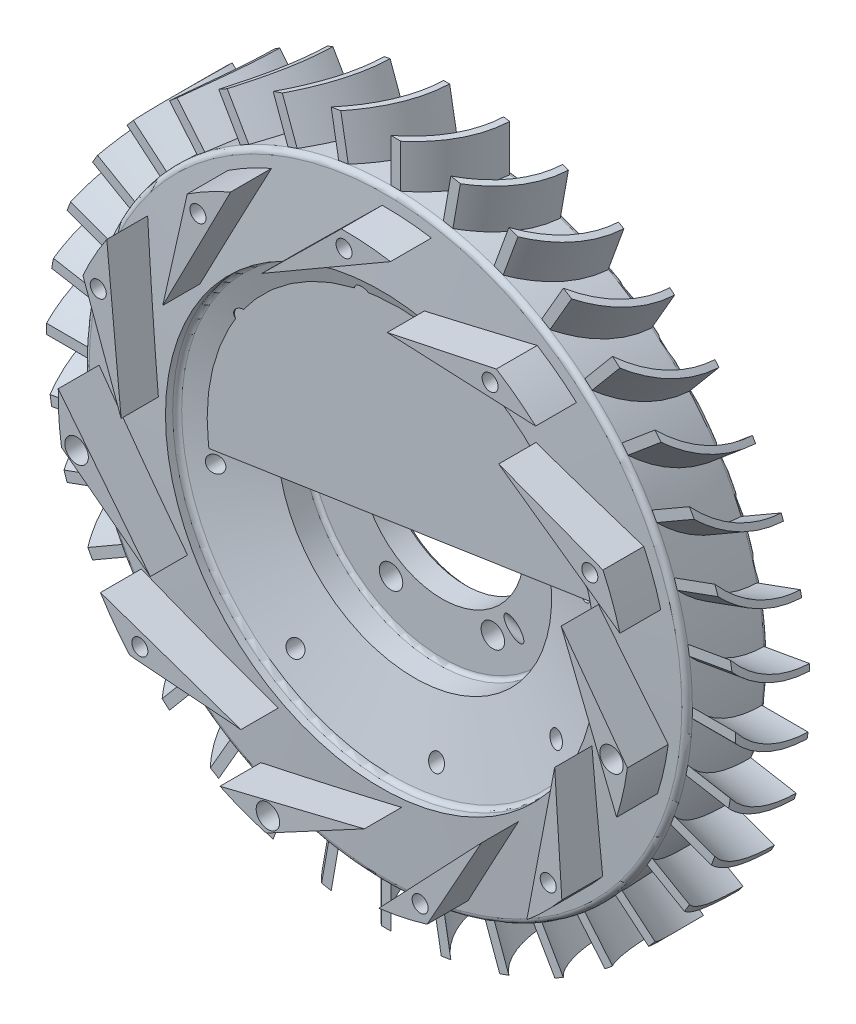
from build123d import *

# Parameters (mm, degrees)
WEDGE_REACH                      = 58.719
M2_5X0_45_TAPPED_HOLE1_D         = 2.05
CIRPATTERN1_COUNT                = 11
F_3_0_3_DIAMETER_HOLE1_D         = 3
CIRPATTERN2_COUNT                = 6
FIN_DEPTH                        = 9
CIRPATTERN3_COUNT                = 36
SKETCH12_OUTSIDE_W               = 118.424
SKETCH12_OUTSIDE_H               = 118.424
SKETCH12_OUTSIDE_R               = 44
FIN_TRIM_DEPTH                   = 67.031333477
CBORE_FOR_M2_5_SHCS1_D           = 2.9
CBORE_FOR_M2_5_SHCS1_CBORE_D     = 6
CBORE_FOR_M2_5_SHCS1_CBORE_DEPTH = 9
LUBE_HOLE_DEPTH                  = 74.452884072
LUBE_HOLE_DEPTH_BACK             = 74.452884072
SKETCH17_R                       = 0.8
CIRPATTERN4_COUNT                = 3
CIRPATTERN4_ANGLE                = 6
CIRPATTERN5_COUNT                = 8


with BuildPart() as part:
    # Sketch1 → Revolve3 (revolve)
    with BuildSketch(Plane(origin=(0, 0, 0), x_dir=(0, 0, -1), z_dir=(1, 0, 0)), mode=Mode.PRIVATE) as revolve3_sk:
        with BuildLine():
            Line((0, 11), (0, 17))
            Line((0, 17), (-1, 20))
            Line((-1, 20), (-3, 20))
            Line((-3, 20), (-3, 21))
            Line((-3, 21), (-3.82, 21))
            ThreePointArc((-3.82, 21), (-4.300832611, 21.199167389), (-4.5, 21.68))
            Line((-4.5, 21.68), (-4.5, 26.32))
            ThreePointArc((-4.5, 26.32), (-4.300832611, 26.800832611), (-3.82, 27))
            Line((-3.82, 27), (-3, 27))
            Line((-3, 27), (-3, 28))
            Line((-3, 28), (-7.565, 30.635603979))
            ThreePointArc((-7.565, 30.635603979), (-8.615492909, 31.686096888), (-9, 33.121096888))
            Line((-9, 33.121096888), (-9, 33.13))
            ThreePointArc((-9, 33.13), (-8.159396462, 35.159396462), (-6.13, 36))
            Line((-6.13, 36), (0, 36))
            Line((0, 36), (0, 37.644699625))
            ThreePointArc((0, 37.644699625), (-0.1403301, 37.99202881), (-0.482550252, 38.144395039))
            Line((-0.482550252, 38.144395039), (-10.001405223, 38.476800779))
            ThreePointArc((-10.001405223, 38.476800779), (-10.483224121, 38.299764596), (-10.704009316, 37.836358555))
            Line((-10.704009316, 37.836358555), (-11.3, 27.5))
            Line((-11.3, 27.5), (-10.379870612, 27.5))
            ThreePointArc((-10.379870612, 27.5), (-9.970636396, 27.363072147), (-9.726212658, 27.007433402))
            Line((-9.726212658, 27.007433402), (-7, 17.5))
            Line((-7, 17.5), (-4, 17.5))
            ThreePointArc((-4, 17.5), (-3.646446609, 17.353553391), (-3.5, 17))
            Line((-3.5, 17), (-3.5, 10.5))
            Line((-3.5, 10.5), (-0.5, 10.5))
            Line((-0.5, 10.5), (0, 11))
        make_face()
    revolve(revolve3_sk.sketch.rotate(Axis((0, 0, 0), (0, 0, 1)), 90), axis=Axis((0, 0, 0), (0, 0, 1)))

    # wedge: up to this cone (the profile starts outside it)
    wedge_end = Plane(origin=(0, 0, 16), z_dir=(0, 0, -1)).offset(3.114360977) * Cone(1.7343e-05, 973.031443417, 56.104639023, align=(Align.CENTER, Align.CENTER, Align.MIN), mode=Mode.PRIVATE)
    # Sketch3 → wedge (add, up to the surface)
    with BuildSketch(Plane.XY.offset(16), mode=Mode.PRIVATE) as wedge_sk1:
        with BuildLine():
            Line((-10.485985773, 26.500832107), (-0.343600772, 36.498382683))
            ThreePointArc((-0.343600772, 36.498382683), (2.80555252, 36.392016639), (5.933797669, 36.014442176))
            Line((5.933797669, 36.014442176), (-10.485985773, 26.500832107))
        make_face()
    wedge_tool1 = extrude(wedge_sk1.sketch, amount=-WEDGE_REACH, mode=Mode.PRIVATE) - wedge_end
    wedge = wedge_tool1.solids().sort_by_distance((-1.558376, 33.05943, 16))[0]
    add(wedge)

    # M2.5x0.45 Tapped Hole1 (through all)
    with Locations(Plane.XY.offset(16)):
        with Locations((0, 34.5)):
            m2_5x0_45_tapped_hole1 = Hole(M2_5X0_45_TAPPED_HOLE1_D / 2)

    # CirPattern1: wedge, M2.5x0.45 Tapped Hole1 ×11 about axis
    cirpattern1_axis = Axis((0, 0, 0), (0, 0, 1))
    add([wedge.rotate(cirpattern1_axis, i * 360 / CIRPATTERN1_COUNT) for i in range(1, CIRPATTERN1_COUNT)])
    add([m2_5x0_45_tapped_hole1.rotate(cirpattern1_axis, i * 360 / CIRPATTERN1_COUNT) for i in range(1, CIRPATTERN1_COUNT)], mode=Mode.SUBTRACT)

    # Ø3.0 (3) Diameter Hole1 (through all)
    with Locations(Plane.XY.offset(16)):
        with Locations((-34.148839745, -4.90986192), (34.148839745, -4.90986192), (-9.719773211, -33.10250759)):
            Hole(F_3_0_3_DIAMETER_HOLE1_D / 2)

    # Sketch8 → Ø3.0 (3) Diameter Hole2 (revolve, cut)
    with BuildSketch(Plane(origin=(-13, 0, 3.5), x_dir=(0, -1, 0), z_dir=(1, 0, 0))):
        Polygon((0, 0), (0, 8.521290929), (1.5, 7.62), (1.5, 0), align=None)
    f_3_0_3_diameter_hole2 = revolve(axis=Axis((-13, 0, 9.85), (0, 0, -1)), mode=Mode.SUBTRACT)

    # CirPattern2: Ø3.0 (3) Diameter Hole2 ×6 about axis
    cirpattern2_axis = Axis((0, 0, 0), (0, 0, 1))
    for i in range(1, CIRPATTERN2_COUNT):
        add(f_3_0_3_diameter_hole2.rotate(cirpattern2_axis, i * 360 / CIRPATTERN2_COUNT), mode=Mode.SUBTRACT)

    # Sketch10 → fin (add)
    with BuildSketch(Plane(origin=(36, 0, 0), x_dir=(0, 0, -1), z_dir=(1, 0, 0))):
        with BuildLine():
            Line((-0.512947118, -5.663253753), (-0.482550252, -4.863831442))
            ThreePointArc((-0.482550252, -4.863831442), (-5.778628269, -3.482177977), (-10.001405223, 0))
            Line((-10.001405223, 0), (-10.001405223, -1.240631147))
            ThreePointArc((-10.001405223, -1.240631147), (-5.703314735, -4.409104626), (-0.512947118, -5.663253753))
        make_face()
    fin = extrude(amount=FIN_DEPTH)

    # CirPattern3: fin ×36 about axis
    cirpattern3_axis = Axis((0, 0, 0), (0, 0, 1))
    for i in range(1, CIRPATTERN3_COUNT):
        add(fin.rotate(cirpattern3_axis, i * 360 / CIRPATTERN3_COUNT))

    # Sketch12 outside → fin trim (cut, through all)
    with BuildSketch(Plane.XY):
        Rectangle(SKETCH12_OUTSIDE_W, SKETCH12_OUTSIDE_H)
        Circle(SKETCH12_OUTSIDE_R, mode=Mode.SUBTRACT)
    extrude(amount=FIN_TRIM_DEPTH, mode=Mode.SUBTRACT)

    # CBORE for M2.5 SHCS1 (through all)
    with Locations(Plane(origin=(35.804193797, 10.531870683, 0), x_dir=(-1, 0, 0), z_dir=(0, 0, -1))):
        with Locations((45.523967008, -43.634378273), (69.953033542, -15.441732604), (1.655354052, -15.441732604)):
            CounterBoreHole(CBORE_FOR_M2_5_SHCS1_D / 2, CBORE_FOR_M2_5_SHCS1_CBORE_D / 2, CBORE_FOR_M2_5_SHCS1_CBORE_DEPTH)

    # Sketch17 → lube hole (cut, two sides: drawn at the far end of the back side and taken through both)
    with BuildSketch(Plane(origin=(5.822639354, -5.822639354, -4.754165125), x_dir=(0.7499999999999962, 0.25000000000000105, 0.6123724356957988), z_dir=(-0.6123724356957988, 0.612372435695792, 0.4999999999999979)).offset(-LUBE_HOLE_DEPTH_BACK)):
        with Locations(Location((6.739497603, -6.739497603, 0), (0, 0, 234.751382781))):
            Circle(SKETCH17_R)
    extrude(amount=LUBE_HOLE_DEPTH + LUBE_HOLE_DEPTH_BACK, mode=Mode.SUBTRACT)

    # Sketch20 → Ø2.0 (2) Diameter Hole3 (revolve, cut)
    with BuildSketch(Plane(origin=(3.524043095, 1.302361333, 7.386058148), x_dir=(0, -0.17364817766692728, -0.9848077530122086), z_dir=(1, 0, 0))):
        Polygon((0, 0), (0, 23.600860619), (1, 23), (1, 0), align=None)
    f_2_0_2_diameter_hole3 = revolve(axis=Axis((3.524043095, -4.951167899, 8.488724076), (0, 0.9848077530122086, -0.17364817766692728)), mode=Mode.SUBTRACT)

    # CirPattern4: Ø2.0 (2) Diameter Hole3 ×3 about axis
    cirpattern4_axis = Axis((3.524043095, -33.213489739, 5.856434364), (0, -0.17364817766693075, -0.984807753012208))
    for i in range(1, CIRPATTERN4_COUNT):
        add(f_2_0_2_diameter_hole3.rotate(cirpattern4_axis, i * CIRPATTERN4_ANGLE / (CIRPATTERN4_COUNT - 1)), mode=Mode.SUBTRACT)

    # Sketch22 → M2.5x0.45 Tapped Hole2 (revolve, cut)
    with BuildSketch(Plane(origin=(-4.682167728, 23.53884673, 4.5), x_dir=(0, 1, 0), z_dir=(1, 0, 0))):
        Polygon((0, 0), (0, 6.965882135), (1.025, 6.35), (1.025, 0), align=None)
    m2_5x0_45_tapped_hole2 = revolve(axis=Axis((-4.682167728, 23.53884673, -1.85), (0, 0, 1)), mode=Mode.SUBTRACT)

    # CirPattern5: M2.5x0.45 Tapped Hole2 ×8 about axis
    cirpattern5_axis = Axis((0, 0, 0), (0, 0, 1))
    for i in range(1, CIRPATTERN5_COUNT):
        add(m2_5x0_45_tapped_hole2.rotate(cirpattern5_axis, i * 360 / CIRPATTERN5_COUNT), mode=Mode.SUBTRACT)


solid = part.part
